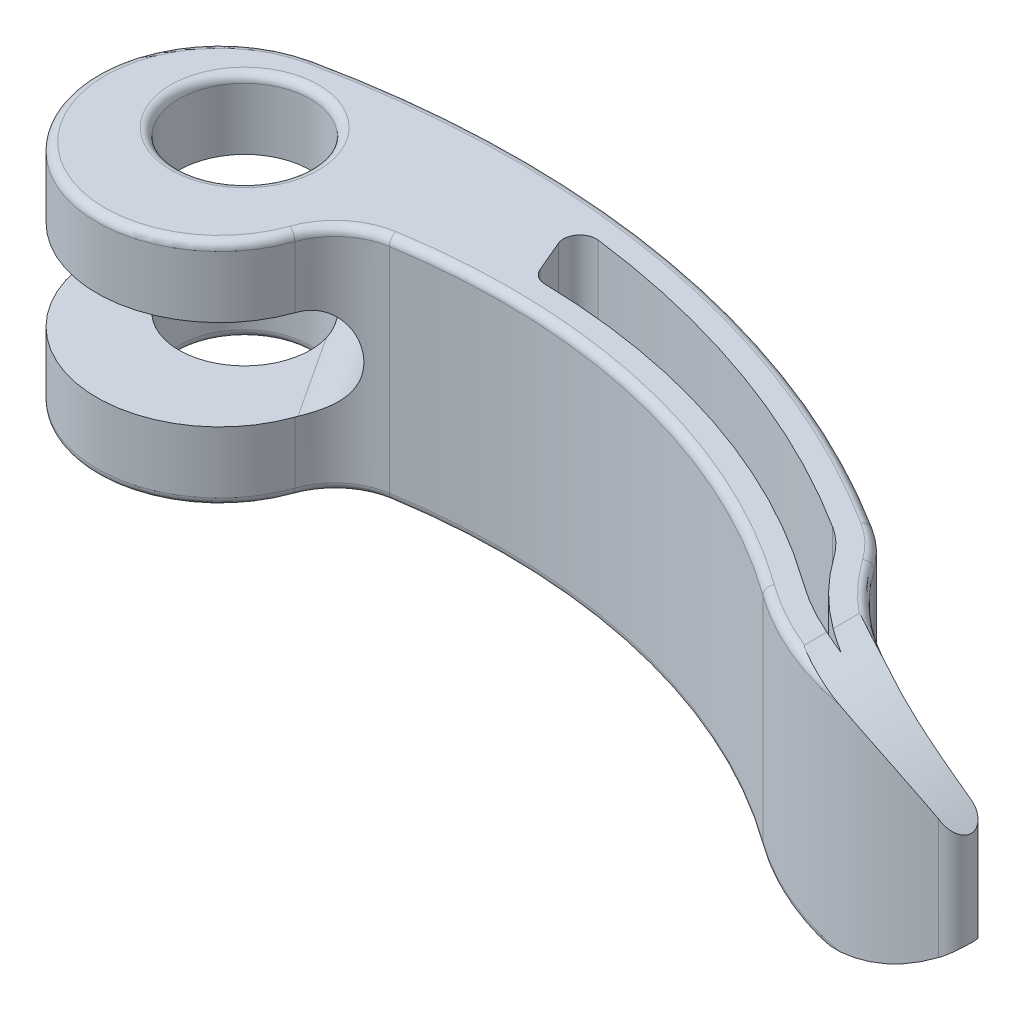
from build123d import *

# Parameters (mm, degrees)
SKETCH1_R               = 4
BOSS_EXTRUDE1_DEPTH     = 7
CUT_EXTRUDE1_DEPTH      = 59.28083506170185
FILLET1_R               = 1
CUT_EXTRUDE2_DEPTH      = 2.75
FILLET2_R               = 2.75
CUT_EXTRUDE4_DEPTH      = 58.005751787773974
CUT_EXTRUDE4_DEPTH_BACK = 58.005751787773974
FILLET5_R               = 0.5


with BuildPart() as part:
    # Sketch1 → Boss-Extrude1 (new, symmetric)
    with BuildSketch(Plane(origin=(0, 0, 0), x_dir=(1, 0, 0), z_dir=(0, 1, 0))):
        with BuildLine():
            ThreePointArc((-1.5362392268059513, 5.800544312960797), (19.919545461636222, 6.102472647508904), (39.91376077319405, -1.6868284373804288))
            ThreePointArc((39.91376077319405, -1.6868284373804288), (41.063548787883846, -2.582083147400275), (42.0185122038675, -3.682782174686955))
            ThreePointArc((42.0185122038675, -3.682782174686955), (47.36674977282913, -8.32744785434), (54.25, -9.999999999999998))
            ThreePointArc((54.25, -9.999999999999998), (55.25, -11), (54.25, -11.999999999999996))
            ThreePointArc((54.25, -11.999999999999996), (46.76493567801582, -11.562886815142743), (39.96682371606345, -8.400145979510366))
            ThreePointArc((39.96682371606345, -8.400145979510366), (25.776397056728037, -1.9297269592280557), (10.190187741321731, -1.3778118857340655))
            ThreePointArc((10.190187741321731, -1.3778118857340655), (8.263501426962312, -2.2586811043636623), (7.056911505750941, -4))
            ThreePointArc((7.056911505750941, -4), (-5.624244199041766, -6.451356526306424), (-1.5362392268059513, 5.800544312960797))
        make_face()
        with Locations(Location((0, 0, 0), (0, 0, 270))):
            Circle(SKETCH1_R, mode=Mode.SUBTRACT)
    extrude(amount=BOSS_EXTRUDE1_DEPTH, both=True)

    # Sketch3 → Cut-Extrude1 (cut, through all)
    with BuildSketch(Plane(origin=(0, 7, 0), x_dir=(1, 0, 0), z_dir=(0, 1, 0))):
        with BuildLine():
            ThreePointArc((38.97786253080241, -3.165542229798767), (27.47285077170822, 2.3415624305985716), (15, 5.010174606274042))
            Line((15, 5.0101746062740515), (16.75, 0.8879868636733343))
            ThreePointArc((16.750000000000004, 0.8879868636733406), (29.48467011233651, -1.151312829335339), (40.989344500632356, -6.979951892378416))
            ThreePointArc((40.98934450063236, -6.979951892378416), (43.289158329312805, -8.390096443432645), (45.7717231121719, -9.445806346940953))
            ThreePointArc((45.77172311217189, -9.445806346940959), (42.92967017584709, -7.345551128742456), (40.59150529431871, -4.695773428400446))
            ThreePointArc((40.59150529431871, -4.695773428400444), (39.85936667539791, -3.8519041741473217), (38.977862530802405, -3.165542229798766))
        make_face()
    extrude(amount=-CUT_EXTRUDE1_DEPTH, mode=Mode.SUBTRACT)

    # Fillet1
    fillet1_edges = [part.edges().sort_by_distance(p)[0] for p in [
        (16.75, 0, -0.887986863673341),
        (15, 0, -5.010174606274051),
    ]]
    fillet(fillet1_edges, radius=FILLET1_R)

    # Sketch4 → Cut-Extrude2 (cut, symmetric)
    with BuildSketch(Plane(origin=(0, 0, 0), x_dir=(1, 0, 0), z_dir=(0, 1, 0))):
        Polygon((0, 12), (-18.3, -2.24e-15), (-6.299999999999993, -18.3), (12.000000000000005, -6.299999999999997), align=None)
    extrude(amount=CUT_EXTRUDE2_DEPTH, both=True, mode=Mode.SUBTRACT)

    # Fillet2
    # the kernel refuses this fillet: 2.75 mm, written as the material it adds along each edge
    with BuildSketch(Plane(origin=(12.791913003977236, -2.75, 7.507667331065273), x_dir=(0, 1, 0), z_dir=(-0.5483569622202411, 0, -0.8362443673858672))) as fillet2_piece_1_section:
        with BuildLine():
            CenterArc((FILLET2_R, -FILLET2_R), FILLET2_R, 90, 90)
            Line((-4.4e-16, -FILLET2_R), (0, 0))
            Line((0, 0), (FILLET2_R, 0))
        make_face()
    fillet2_piece_1 = extrude(amount=23.77266181811646, mode=Mode.PRIVATE)
    fillet2_piece_1 = fillet2_piece_1 - Plane(origin=(10.830660974066888, -2.75, 5.326203208556105), x_dir=(-0.1601183081862921, 0, -0.9870978307055283), z_dir=(0, 1, 0)) * Cylinder(3.9999999999999254, 59, mode=Mode.PRIVATE)
    fillet2_piece_1 = fillet2_piece_1 & Plane(origin=(9.965017016661069, -2.75, 49.00566979476703), x_dir=(-0.205379575776197, 0, -0.9786823947808551), z_dir=(0, 1, 0)) * Cylinder(55.99999999999994, 59, mode=Mode.PRIVATE)
    fillet2_piece_1 = fillet2_piece_1 - Plane(origin=(0, -2.75, 0), x_dir=(-1.8e-16, 0, 1), z_dir=(0, -1, 0)) * Cylinder(4, 59, mode=Mode.PRIVATE)
    add(fillet2_piece_1)
    with BuildSketch(Plane(origin=(12.791913003977236, 2.75, 7.507667331065273), x_dir=(-0.8362443673858672, 0, 0.548356962220241), z_dir=(-0.5483569622202411, 0, -0.8362443673858672))) as fillet2_piece_2_section:
        with BuildLine():
            CenterArc((FILLET2_R, -FILLET2_R), FILLET2_R, 90, 90)
            Line((0, -FILLET2_R), (0, 0))
            Line((0, 0), (FILLET2_R, 0))
        make_face()
    fillet2_piece_2 = extrude(amount=23.77266181811646, mode=Mode.PRIVATE)
    fillet2_piece_2 = fillet2_piece_2 - Plane(origin=(10.830660974066888, 2.75, 5.326203208556105), x_dir=(-0.1601183081862921, 0, -0.9870978307055283), z_dir=(0, 1, 0)) * Cylinder(3.9999999999999254, 59, mode=Mode.PRIVATE)
    fillet2_piece_2 = fillet2_piece_2 & Plane(origin=(9.965017016661069, 2.75, 49.00566979476703), x_dir=(-0.205379575776197, 0, -0.9786823947808551), z_dir=(0, 1, 0)) * Cylinder(55.99999999999994, 59, mode=Mode.PRIVATE)
    fillet2_piece_2 = fillet2_piece_2 - Plane(origin=(0, 2.75, 0), x_dir=(-1.8e-16, 0, 1), z_dir=(0, -1, 0)) * Cylinder(4, 59, mode=Mode.PRIVATE)
    add(fillet2_piece_2)

    # Sketch5 → Cut-Extrude4 (cut, two sides: drawn at the far end of the back side and taken through both)
    with BuildSketch(Plane.XY.offset(-CUT_EXTRUDE4_DEPTH_BACK)):
        with BuildLine():
            Line((-72.98716670228313, -9.980836435146946), (44.34999999999997, -7))
            ThreePointArc((44.34999999999997, -7), (51.97321481572282, -5.056518890659532), (58, 0))
            ThreePointArc((58, 0), (51.97321481572283, 5.056518890659516), (44.35, 7))
            Line((44.35, 7), (-72.98716670228305, 9.980836435148523))
            Line((-72.98716670228305, 9.980836435148523), (161.76287973496454, 9.980836435147522))
            Line((161.76287973496454, 9.980836435147522), (161.76287973496446, -9.980836435147948))
            Line((161.76287973496446, -9.980836435147948), (-72.98716670228313, -9.980836435146946))
        make_face()
    extrude(amount=CUT_EXTRUDE4_DEPTH + CUT_EXTRUDE4_DEPTH_BACK, mode=Mode.SUBTRACT)

    # Fillet5
    # the kernel refuses this fillet: 0.5 mm, written as the material it takes off along each edge
    with BuildSketch(Plane(origin=(54.25000000000004, -7, -5.000000000000073), x_dir=(-0.8154325197421656, 0, 0.5788521449791326), z_dir=(-0.5788521449791326, 0, -0.8154325197421656))) as fillet5_piece_1:
        with BuildLine():
            CenterArc((15.00000000000007 + FILLET5_R, FILLET5_R), FILLET5_R, 180, 90)
            Line((15.000000000000071, FILLET5_R), (15.00000000000007, 0))
            Line((15.00000000000007, 0), (15.00000000000007 + FILLET5_R, 0))
        make_face()
    revolve(axis=Axis((54.25000000000004, -7, -5.000000000000073), (0, 1, 0)), revolution_arc=37.203729931637106, mode=Mode.SUBTRACT)
    with BuildSketch(Plane(origin=(35.90276830580119, -7, 8.024173262030505), x_dir=(0.5347989956523749, 0, -0.8449793099533331), z_dir=(-0.8449793099533331, 0, -0.5347989956523749))) as fillet5_piece_2:
        with BuildLine():
            CenterArc((7.5000000000000915 - FILLET5_R, -FILLET5_R), FILLET5_R, 0, 90)
            Line((7.5000000000000915, -FILLET5_R), (7.5000000000000915, 0))
            Line((7.5000000000000915, 0), (7.5000000000000915 - FILLET5_R, 0))
        make_face()
    revolve(axis=Axis((35.90276830580119, -7, 8.024173262030505), (0, -1, 0)), revolution_arc=22.29987011056575, mode=Mode.SUBTRACT)
    with BuildSketch(Plane(origin=(51.65277553970825, -7, -7.8306435877121405), x_dir=(-0.06124033983071464, 0, 0.9981230489160234), z_dir=(0.9981230489160234, 0, 0.06124033983071464))) as fillet5_piece_3:
        with BuildLine():
            CenterArc((20.00000000000016 - FILLET5_R, -FILLET5_R), FILLET5_R, 0, 90)
            Line((20.000000000000156, -FILLET5_R), (20.00000000000016, 0))
            Line((20.00000000000016, 0), (20.00000000000016 - FILLET5_R, 0))
        make_face()
    revolve(axis=Axis((51.65277553970825, -7, -7.8306435877121405), (0, -1, 0)), revolution_arc=32.24237358816158, mode=Mode.SUBTRACT)
    with BuildSketch(Plane(origin=(16.59492006877398, -7, 40.86172511395514), x_dir=(0.5842975911822361, 0, -0.8115394783611185), z_dir=(0.8115394783611185, 0, 0.5842975911822361))) as fillet5_piece_4:
        with BuildLine():
            CenterArc((40.00000000000002 + FILLET5_R, FILLET5_R), FILLET5_R, 180, 90)
            Line((40.00000000000002, FILLET5_R), (40.00000000000002, 0))
            Line((40.00000000000002, 0), (40.00000000000002 + FILLET5_R, 0))
        make_face()
    revolve(axis=Axis((16.59492006877398, -7, 40.86172511395514), (0, 1, 0)), revolution_arc=44.96714685168292, mode=Mode.SUBTRACT)
    with BuildSketch(Plane(origin=(10.830660974066888, -7, 5.326203208556105), x_dir=(-0.16011830818629214, 0, -0.9870978307055283), z_dir=(0.9870978307055283, 0, -0.16011830818629214))) as fillet5_piece_5:
        with BuildLine():
            CenterArc((3.999999999999926 + FILLET5_R, FILLET5_R), FILLET5_R, 180, 90)
            Line((3.9999999999999267, FILLET5_R), (3.999999999999926, 0))
            Line((3.999999999999926, 0), (3.999999999999926 + FILLET5_R, 0))
        make_face()
    revolve(axis=Axis((10.830660974066888, -7, 5.326203208556105), (0, 1, 0)), revolution_arc=61.423306762485126, mode=Mode.SUBTRACT)
    with BuildSketch(Plane(origin=(4.16e-15, -7, 1.5199999999999974), x_dir=(0.9434373670790025, 0, 0.33155080213903787), z_dir=(0.33155080213903787, 0, -0.9434373670790025))) as fillet5_piece_6:
        with BuildLine():
            CenterArc((7.479999999999999 - FILLET5_R, -FILLET5_R), FILLET5_R, 0, 90)
            Line((7.479999999999999, -FILLET5_R), (7.479999999999999, 0))
            Line((7.479999999999999, 0), (7.479999999999999 - FILLET5_R, 0))
        make_face()
    revolve(axis=Axis((4.16e-15, -7, 1.5199999999999974), (0, -1, 0)), revolution_arc=238.78535012747108, mode=Mode.SUBTRACT)
    with BuildSketch(Plane(origin=(54.25000000000004, 7, -5.000000000000073), x_dir=(-0.8154325197421656, 0, 0.5788521449791326), z_dir=(-0.5788521449791326, 0, -0.8154325197421656))) as fillet5_piece_7:
        with BuildLine():
            CenterArc((15.00000000000007 + FILLET5_R, -FILLET5_R), FILLET5_R, 90, 90)
            Line((15.00000000000007, -FILLET5_R), (15.00000000000007, 0))
            Line((15.00000000000007, 0), (15.00000000000007 + FILLET5_R, 0))
        make_face()
    revolve(axis=Axis((54.25000000000004, 7, -5.000000000000073), (0, 1, 0)), revolution_arc=37.20372993163729, mode=Mode.SUBTRACT)
    with BuildSketch(Plane(origin=(35.90276830580119, 7, 8.024173262030505), x_dir=(0.5347989956523749, 0, -0.8449793099533331), z_dir=(-0.8449793099533331, 0, -0.5347989956523749))) as fillet5_piece_8:
        with BuildLine():
            CenterArc((7.5000000000000915 - FILLET5_R, FILLET5_R), FILLET5_R, 270, 90)
            Line((7.5000000000000915, FILLET5_R), (7.5000000000000915, 0))
            Line((7.5000000000000915, 0), (7.5000000000000915 - FILLET5_R, 0))
        make_face()
    revolve(axis=Axis((35.90276830580119, 7, 8.024173262030505), (0, -1, 0)), revolution_arc=22.29987011056575, mode=Mode.SUBTRACT)
    with BuildSketch(Plane(origin=(9.965017016661069, 7, 49.00566979476703), x_dir=(-0.205379575776197, 0, -0.9786823947808551), z_dir=(-0.9786823947808551, 0, 0.205379575776197))) as fillet5_piece_9:
        with BuildLine():
            CenterArc((55.99999999999994 - FILLET5_R, FILLET5_R), FILLET5_R, 270, 90)
            Line((55.99999999999994, FILLET5_R), (55.99999999999994, 0))
            Line((55.99999999999994, 0), (55.99999999999994 - FILLET5_R, 0))
        make_face()
    revolve(axis=Axis((9.965017016661069, 7, 49.00566979476703), (0, -1, 0)), revolution_arc=44.182000772164294, mode=Mode.SUBTRACT)
    with BuildSketch(Plane(origin=(51.65277553970825, 7, -7.8306435877121405), x_dir=(-0.06124033983071322, 0, 0.9981230489160237), z_dir=(0.9981230489160237, 0, 0.06124033983071322))) as fillet5_piece_10:
        with BuildLine():
            CenterArc((20.000000000000163 - FILLET5_R, FILLET5_R), FILLET5_R, 270, 90)
            Line((20.000000000000163, FILLET5_R), (20.000000000000163, 0))
            Line((20.000000000000163, 0), (20.000000000000163 - FILLET5_R, 0))
        make_face()
    revolve(axis=Axis((51.65277553970825, 7, -7.8306435877121405), (0, -1, 0)), revolution_arc=32.24237358816166, mode=Mode.SUBTRACT)
    with BuildSketch(Plane(origin=(16.59492006877398, 7, 40.86172511395514), x_dir=(0.5842975911822361, 0, -0.8115394783611185), z_dir=(0.8115394783611185, 0, 0.5842975911822361))) as fillet5_piece_11:
        with BuildLine():
            CenterArc((40.00000000000002 + FILLET5_R, -FILLET5_R), FILLET5_R, 90, 90)
            Line((40.00000000000002, -FILLET5_R), (40.00000000000002, 0))
            Line((40.00000000000002, 0), (40.00000000000002 + FILLET5_R, 0))
        make_face()
    revolve(axis=Axis((16.59492006877398, 7, 40.86172511395514), (0, 1, 0)), revolution_arc=44.96714685168292, mode=Mode.SUBTRACT)
    with BuildSketch(Plane(origin=(10.830660974066888, 7, 5.326203208556105), x_dir=(-0.16011830818629214, 0, -0.9870978307055283), z_dir=(0.9870978307055283, 0, -0.16011830818629214))) as fillet5_piece_12:
        with BuildLine():
            CenterArc((3.999999999999926 + FILLET5_R, -FILLET5_R), FILLET5_R, 90, 90)
            Line((3.9999999999999267, -FILLET5_R), (3.999999999999926, 0))
            Line((3.999999999999926, 0), (3.999999999999926 + FILLET5_R, 0))
        make_face()
    revolve(axis=Axis((10.830660974066888, 7, 5.326203208556105), (0, 1, 0)), revolution_arc=61.423306762485126, mode=Mode.SUBTRACT)
    with BuildSketch(Plane(origin=(0, -7, 0), x_dir=(-1.8e-16, 0, 1), z_dir=(-1, 0, -1.8e-16))) as fillet5_piece_13:
        with BuildLine():
            CenterArc((4 + FILLET5_R, FILLET5_R), FILLET5_R, 180, 90)
            Line((4, FILLET5_R), (4, 0))
            Line((4, 0), (4 + FILLET5_R, 0))
        make_face()
    revolve(axis=Axis((0, -7, 0), (0, 1, 0)), mode=Mode.SUBTRACT)
    with BuildSketch(Plane(origin=(9.965017016661069, -7, 49.00566979476703), x_dir=(-0.205379575776197, 0, -0.9786823947808551), z_dir=(-0.9786823947808551, 0, 0.205379575776197))) as fillet5_piece_14:
        with BuildLine():
            CenterArc((55.99999999999994 - FILLET5_R, -FILLET5_R), FILLET5_R, 0, 90)
            Line((55.99999999999994, -FILLET5_R), (55.99999999999994, 0))
            Line((55.99999999999994, 0), (55.99999999999994 - FILLET5_R, 0))
        make_face()
    revolve(axis=Axis((9.965017016661069, -7, 49.00566979476703), (0, -1, 0)), revolution_arc=44.182000772164294, mode=Mode.SUBTRACT)
    with BuildSketch(Plane(origin=(4.16e-15, 7, 1.5199999999999974), x_dir=(0.9434373670790025, 0, 0.33155080213903787), z_dir=(0.33155080213903787, 0, -0.9434373670790025))) as fillet5_piece_15:
        with BuildLine():
            CenterArc((7.479999999999999 - FILLET5_R, FILLET5_R), FILLET5_R, 270, 90)
            Line((7.479999999999999, FILLET5_R), (7.479999999999999, 0))
            Line((7.479999999999999, 0), (7.479999999999999 - FILLET5_R, 0))
        make_face()
    revolve(axis=Axis((4.16e-15, 7, 1.5199999999999974), (0, -1, 0)), revolution_arc=238.78535012747108, mode=Mode.SUBTRACT)
    with BuildSketch(Plane(origin=(0, 7, 0), x_dir=(-1.8e-16, 0, 1), z_dir=(-1, 0, -1.8e-16))) as fillet5_piece_16:
        with BuildLine():
            CenterArc((4 + FILLET5_R, -FILLET5_R), FILLET5_R, 90, 90)
            Line((4 + FILLET5_R, 0), (4, 0))
            Line((4, 0), (4, -FILLET5_R))
        make_face()
    revolve(axis=Axis((0, 7, 0), (0, 1, 0)), mode=Mode.SUBTRACT)


solid = part.part
